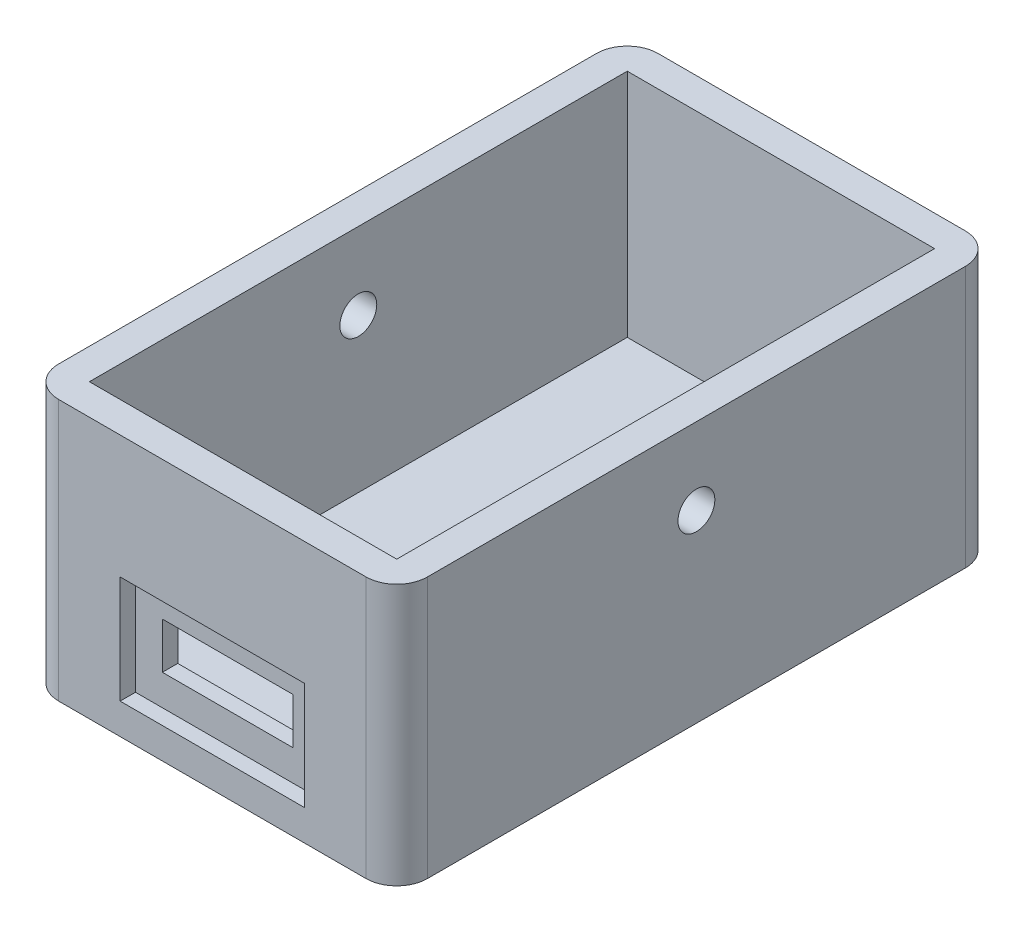
from build123d import *

# Parameters (mm, degrees)
IZIM1_W                     = 24
IZIM1_H                     = 39
Y_KSEKLIK_EKSTR_ZYON1_DEPTH = 17
RADYUS1_R                   = 2
BO_ALTMA1_START             = -12.470588235
BO_ALTMA1_OUTLINE_W         = 15
BO_ALTMA1_OUTLINE_H         = 35
BO_ALTMA1_DEPTH             = 20
IZIM2_W                     = 8.5
IZIM2_H                     = 3
KES_EKSTR_ZYON1_DEPTH       = 17
IZIM3_W                     = 12
IZIM3_H                     = 7
KES_EKSTR_ZYON2_DEPTH       = 1
IZIM5_R                     = 1.2
KES_EKSTR_ZYON3_DEPTH       = 30


# Read off the part's stored shape, not the designer's step: İç Boşaltma1
with BuildPart() as part:
    # Çizim1 → Yükseklik-Ekstrüzyon1 (new body)
    with BuildSketch(Plane(origin=(0, 0, 0), x_dir=(1, 0, 0), z_dir=(0, 1, 0))):
        with Locations((-2.470588235, -5.382352941)):
            Rectangle(IZIM1_W, IZIM1_H)
    extrude(amount=Y_KSEKLIK_EKSTR_ZYON1_DEPTH)

    # Radyus1
    radyus1_edges = [part.edges().sort_by_distance(p)[0] for p in [
        (-14.470588235, 8.5, -14.117647059),
        (9.529411765, 8.5, -14.117647059),
        (9.529411765, 8.5, 24.882352941),
        (-14.470588235, 8.5, 24.882352941),
    ]]
    fillet(radyus1_edges, radius=RADYUS1_R)

    # İç Boşaltma1 outline → İç Boşaltma1 (cut)
    with BuildSketch(Plane.YZ.offset(BO_ALTMA1_START)):
        with Locations((9.5, 5.382352941)):
            Rectangle(BO_ALTMA1_OUTLINE_W, BO_ALTMA1_OUTLINE_H)
    extrude(amount=BO_ALTMA1_DEPTH, mode=Mode.SUBTRACT)

    # Çizim2 → Kes-Ekstrüzyon1 (cut)
    with BuildSketch(Plane.XY.offset(24.882352941)):
        with Locations((-2.470588235, 5.5)):
            Rectangle(IZIM2_W, IZIM2_H)
    extrude(amount=-KES_EKSTR_ZYON1_DEPTH, mode=Mode.SUBTRACT)

    # Çizim3 → Kes-Ekstrüzyon2 (cut)
    with BuildSketch(Plane.XY.offset(24.882352941)):
        with Locations((-2.470588235, 5.5)):
            Rectangle(IZIM3_W, IZIM3_H)
    extrude(amount=-KES_EKSTR_ZYON2_DEPTH, mode=Mode.SUBTRACT)

    # Çizim5 → Kes-Ekstrüzyon3 (cut)
    with BuildSketch(Plane(origin=(9.529411765, 0, 0), x_dir=(0, 0, -1), z_dir=(1, 0, 0))):
        with Locations((-5.382352941, 12)):
            Circle(IZIM5_R)
    extrude(amount=-KES_EKSTR_ZYON3_DEPTH, mode=Mode.SUBTRACT)


solid = part.part
